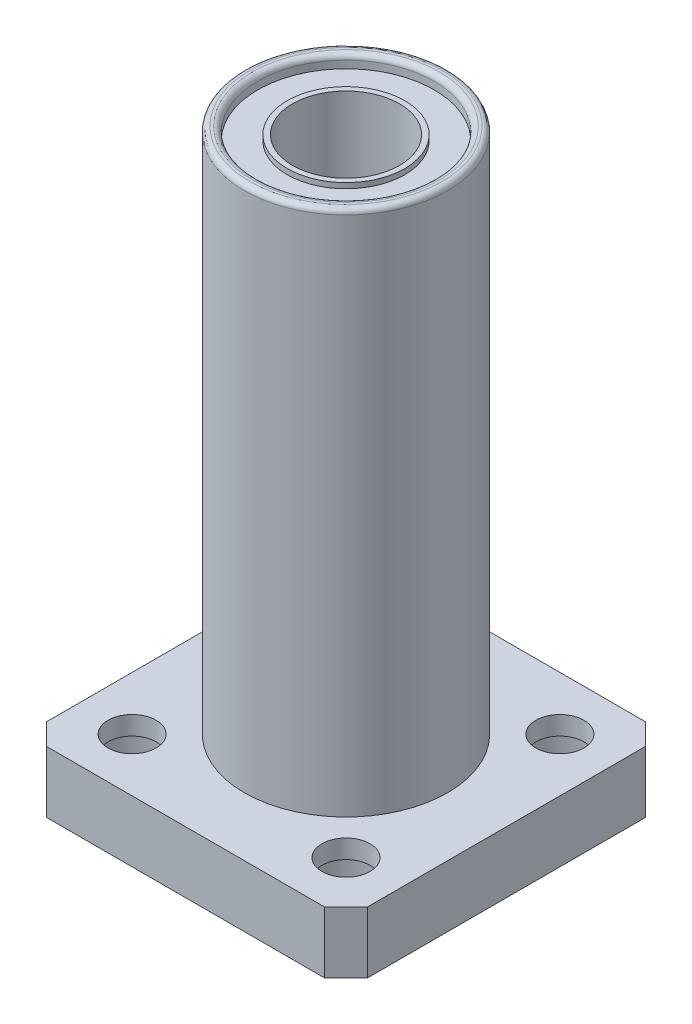
from build123d import *
from build123d.topology import SkipClean

# Parameters (mm, degrees)
SKETCH1_W                     = 30
SKETCH1_H                     = 30
SKETCH1_R                     = 9.5
BOSS_EXTRUDE1_DEPTH           = 5.75
SKETCH1_2_R                   = 9.5
BOSS_EXTRUDE3_DEPTH           = 55
SPLIT1_OUTLINE_R              = 9.5
SPLIT1_OUTLINE_R_2            = 8.25
SPLIT1_DEPTH                  = 55
SPLIT1_2_OUTLINE_R            = 9.5
SPLIT1_2_OUTLINE_R_2          = 8.25
SPLIT1_2_DEPTH                = 55
MOVE_START                    = 53.8
MOVE_FACE1_OUTLINE_R          = 8.25
MOVE_FACE1_DEPTH              = 1.2
MOVE_FACE2_OUTLINE_R          = 8.25
MOVE_FACE2_DEPTH              = 1.2
SKETCH5_R                     = 5
CUT_EXTRUDE1_DEPTH            = 58.831133484
SKETCH6_R                     = 5.5
SKETCH6_R_2                   = 5
EXTRUDE_THIN1_DEPTH           = 0.5
SKETCH7_R                     = 5.5
SKETCH7_R_2                   = 5
EXTRUDE_THIN2_DEPTH           = 0.5
FILLET1_R                     = 0.5
CBORE_FOR_M4_SHCS1_AT_2_COUNT = 2
CBORE_FOR_M4_SHCS1_AT_2_PITCH = 20
CBORE_FOR_M4_SHCS1_AT_3_COUNT = 2
CBORE_FOR_M4_SHCS1_AT_3_PITCH = 28.284271247
CBORE_FOR_M4_SHCS1_AT_4_COUNT = 2
CBORE_FOR_M4_SHCS1_AT_4_PITCH = 20
CHAMFER1_SIZE                 = 2


# Read off the part's stored shape, not the designer's step: Split1, Move Face1, Move Face2
with BuildPart() as part:
    # Sketch1 → Boss-Extrude1 (new body)
    with BuildSketch(Plane(origin=(0, 0, 0), x_dir=(1, 0, 0), z_dir=(0, 1, 0))):
        Rectangle(SKETCH1_W, SKETCH1_H)
        with Locations(Location((0, 0, 0), (0, 0, 270))):
            Circle(SKETCH1_R, mode=Mode.SUBTRACT)
    extrude(amount=BOSS_EXTRUDE1_DEPTH)

    # Sketch10 → CBORE for M4 SHCS1 (revolve, cut)
    with BuildSketch(Plane(origin=(10, 0, 10), x_dir=(0, 0, -1), z_dir=(1, 0, 0))):
        Polygon((0, 0), (0, 5.751), (2.25, 5.751), (2.25, 4), (4, 4), (4, 0.25), (4.25, 0), align=None)
    cbore_for_m4_shcs1 = revolve(axis=Axis((10, -6.35, 10), (0, 1, 0)), mode=Mode.SUBTRACT)

    # CBORE for M4 SHCS1 at 2: CBORE for M4 SHCS1 ×2
    with Locations(*[(0, 0, -i * CBORE_FOR_M4_SHCS1_AT_2_PITCH) for i in range(1, CBORE_FOR_M4_SHCS1_AT_2_COUNT)]):
        add(cbore_for_m4_shcs1, mode=Mode.SUBTRACT)

    # CBORE for M4 SHCS1 at 3: CBORE for M4 SHCS1 ×2
    with Locations(*[Vector(-0.7071067811865476, 0, -0.7071067811865476) * (i * CBORE_FOR_M4_SHCS1_AT_3_PITCH) for i in range(1, CBORE_FOR_M4_SHCS1_AT_3_COUNT)]):
        add(cbore_for_m4_shcs1, mode=Mode.SUBTRACT)

    # CBORE for M4 SHCS1 at 4: CBORE for M4 SHCS1 ×2
    with Locations(*[(-i * CBORE_FOR_M4_SHCS1_AT_4_PITCH, 0, 0) for i in range(1, CBORE_FOR_M4_SHCS1_AT_4_COUNT)]):
        add(cbore_for_m4_shcs1, mode=Mode.SUBTRACT)

    # Chamfer1
    chamfer1_edges = [part.edges().sort_by_distance(p)[0] for p in [
        (15, 2.875, 15),
        (-15, 2.875, 15),
        (-15, 2.875, -15),
        (15, 2.875, -15),
    ]]
    chamfer(chamfer1_edges, length=CHAMFER1_SIZE)


with BuildPart() as body_2:
    # Sketch1<2> → Boss-Extrude3 (new body)
    with BuildSketch(Plane(origin=(0, 0, 0), x_dir=(1, 0, 0), z_dir=(0, 1, 0))):
        with Locations(Location((0, 0, 0), (0, 0, 270))):
            Circle(SKETCH1_2_R)
    extrude(amount=BOSS_EXTRUDE3_DEPTH)

    # Split1 outline → Split1 (cut)
    with BuildSketch(Plane(origin=(0, 0, 0), x_dir=(1, 0, 0), z_dir=(0, 1, 0))):
        Circle(SPLIT1_OUTLINE_R)
        Circle(SPLIT1_OUTLINE_R_2, mode=Mode.SUBTRACT)
    extrude(amount=SPLIT1_DEPTH, mode=Mode.SUBTRACT)

    # Move Face1 outline → Move Face1 (cut)
    with BuildSketch(Plane(origin=(0, 0, 0), x_dir=(1, 0, 0), z_dir=(0, 1, 0)).offset(MOVE_START)):
        Circle(MOVE_FACE1_OUTLINE_R)
    extrude(amount=MOVE_FACE1_DEPTH, mode=Mode.SUBTRACT)

    # Move Face2 outline → Move Face2 (cut)
    with BuildSketch(Plane(origin=(0, 0, 0), x_dir=(1, 0, 0), z_dir=(0, 1, 0))):
        Circle(MOVE_FACE2_OUTLINE_R)
    extrude(amount=MOVE_FACE2_DEPTH, mode=Mode.SUBTRACT)

    # Sketch5 → Cut-Extrude1 (cut, through all)
    with BuildSketch(Plane(origin=(0, 53.8, 0), x_dir=(1, 0, 0), z_dir=(0, 1, 0))):
        with Locations(Location((0, 0, 0), (0, 0, 270))):
            Circle(SKETCH5_R)
    extrude(amount=-CUT_EXTRUDE1_DEPTH, mode=Mode.SUBTRACT)

    # Sketch6 → Extrude-Thin1 (add)
    with SkipClean():  # the faces are left unmerged after this step: merging them gives an invalid solid
        with BuildSketch(Plane(origin=(0, 53.8, 0), x_dir=(1, 0, 0), z_dir=(0, 1, 0))):
            Circle(SKETCH6_R)
            Circle(SKETCH6_R_2, mode=Mode.SUBTRACT)
        extrude(amount=EXTRUDE_THIN1_DEPTH)
    add(body_2.part.scale(1), mode=Mode.REPLACE)  # the faces are merged on a copy

    # Sketch7 → Extrude-Thin2 (add)
    with SkipClean():  # the faces are left unmerged after this step: merging them gives an invalid solid
        with BuildSketch(Plane.XZ.offset(-1.2)):
            Circle(SKETCH7_R)
            Circle(SKETCH7_R_2, mode=Mode.SUBTRACT)
        extrude(amount=EXTRUDE_THIN2_DEPTH)


with BuildPart() as body_3:
    # Split1 2 outline → Split1 2 (new body)
    with BuildSketch(Plane(origin=(0, 0, 0), x_dir=(1, 0, 0), z_dir=(0, 1, 0))):
        Circle(SPLIT1_2_OUTLINE_R)
        Circle(SPLIT1_2_OUTLINE_R_2, mode=Mode.SUBTRACT)
    extrude(amount=SPLIT1_2_DEPTH)

    # Fillet1
    fillet1_edges = [body_3.edges().sort_by_distance(p)[0] for p in [
        (-8.25, 55, 0),
        (-9.5, 55, 0),
        (-8.25, 0, 0),
    ]]
    fillet(fillet1_edges, radius=FILLET1_R)


solid = Compound([part.part, body_2.part, body_3.part])
